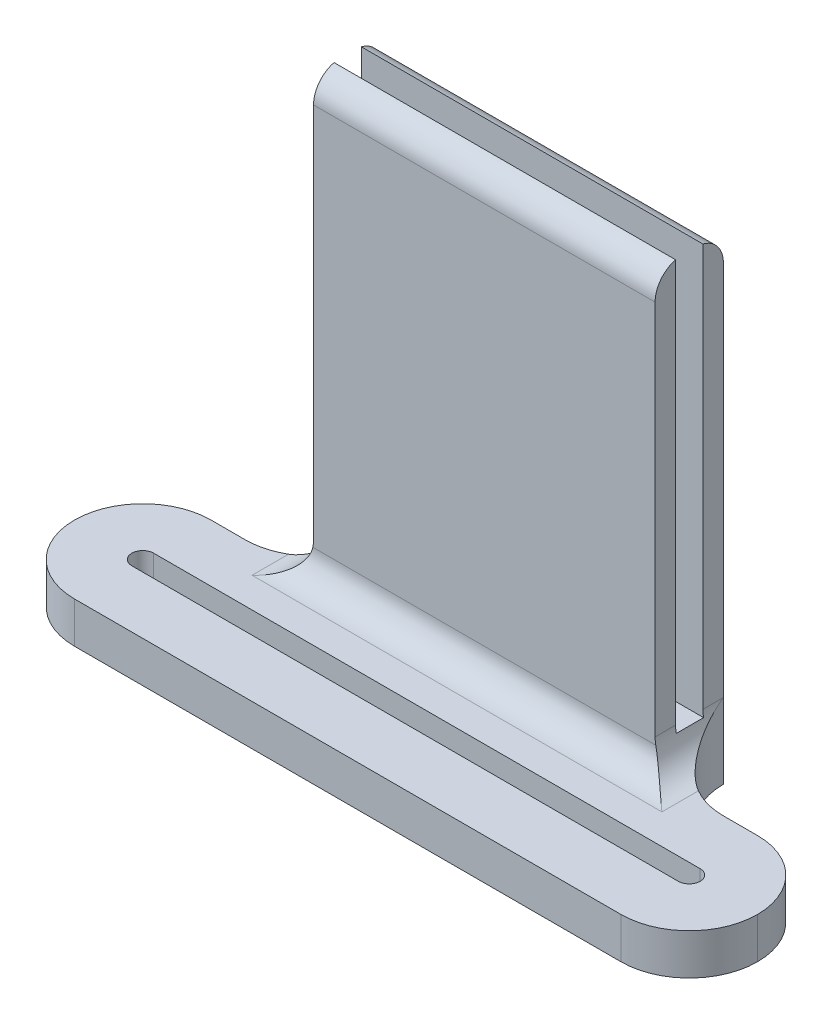
from build123d import *
from build123d.topology import SkipClean

# Parameters (mm, degrees)
SKETCH1_W           = 50
SKETCH1_H           = 10
BOSS_EXTRUDE1_DEPTH = 70
SKETCH2_W           = 50
SKETCH2_H           = 4
CUT_EXTRUDE1_DEPTH  = 60
SKETCH3_W           = 100
SKETCH3_H           = 6
BOSS_EXTRUDE2_DEPTH = 20
FILLET1_R           = 10
FILLET2_R           = 10
FILLET3_R           = 5
CUT_EXTRUDE2_DEPTH  = 85.976467331
FILLET4_R           = 4
FILLET5_R           = 4


# Some blends are built 0.0001 mm under size
with BuildPart() as part:
    # Sketch1 → Boss-Extrude1 (new body)
    with BuildSketch(Plane(origin=(0, 0, 0), x_dir=(1, 0, 0), z_dir=(0, 1, 0))):
        Rectangle(SKETCH1_W, SKETCH1_H)
    extrude(amount=BOSS_EXTRUDE1_DEPTH)

    # Sketch2 → Cut-Extrude1 (cut)
    with BuildSketch(Plane(origin=(0, 70, 0), x_dir=(1, 0, 0), z_dir=(0, 1, 0))):
        Rectangle(SKETCH2_W, SKETCH2_H)
    extrude(amount=-CUT_EXTRUDE1_DEPTH, mode=Mode.SUBTRACT)

    # Sketch3 → Boss-Extrude2 (add)
    with BuildSketch(Plane.XY.offset(5)):
        with Locations((0, 3)):
            Rectangle(SKETCH3_W, SKETCH3_H)
    extrude(amount=BOSS_EXTRUDE2_DEPTH)

    # Fillet1
    fillet1_edges = [part.edges().sort_by_distance(p)[0] for p in [
        (50, 3, 25),
        (-50, 3, 25),
        (-50, 3, 5),
        (50, 3, 5),
    ]]
    fillet(fillet1_edges, radius=FILLET1_R - 0.0001)  # a hair under: the kernel refuses the full size

    # Fillet2
    fillet2_edges = [part.edges().sort_by_distance(p)[0] for p in [
        (-25, 3, 5),
        (25, 3, 5),
    ]]
    fillet(fillet2_edges, radius=FILLET2_R - 0.0001)  # a hair under: the kernel refuses the full size

    # Fillet3
    # the kernel refuses this fillet: 5 mm, written as the material it adds along each edge
    with BuildSketch(Plane(origin=(-25, 6, 5), x_dir=(-1, 0, 0), z_dir=(0, 0, -1))) as fillet3_piece_1_section:
        with BuildLine():
            CenterArc((FILLET3_R, FILLET3_R), FILLET3_R, 180, 90)
            Line((0, FILLET3_R), (0, 0))
            Line((0, 0), (FILLET3_R, 0))
        make_face()
    fillet3_piece_1 = extrude(amount=22.4999, mode=Mode.PRIVATE)
    fillet3_piece_1 = fillet3_piece_1 - Plane(origin=(-34.9999, 7.107412722, -4.9999), x_dir=(0, 0, 1), z_dir=(0, 1, 0)) * Cylinder(9.9999, 65, mode=Mode.PRIVATE)
    fillet3_piece_1 = split(fillet3_piece_1, bisect_by=Plane(origin=(-26.097313128, 7.107412722, -5), z_dir=(0, 0, 1)), keep=Keep.TOP, mode=Mode.PRIVATE)
    fillet3_piece_1 = split(fillet3_piece_1, bisect_by=Plane(origin=(-26.097313128, 10, 3.51164162), z_dir=(0, -1, 0)), keep=Keep.TOP, mode=Mode.PRIVATE)
    add(fillet3_piece_1)
    with BuildSketch(Plane(origin=(-25, 6, 5), x_dir=(-1, 0, 0), z_dir=(0, 0, -1))) as fillet3_piece_2_section:
        with BuildLine():
            CenterArc((FILLET3_R, FILLET3_R), FILLET3_R, 180, 90)
            Line((0, FILLET3_R), (0, 0))
            Line((0, 0), (FILLET3_R, 0))
        make_face()
    fillet3_piece_2 = extrude(amount=22.4999, mode=Mode.PRIVATE)
    fillet3_piece_2 = split(fillet3_piece_2, bisect_by=Plane(origin=(-25.030252938, 10, 3.5), z_dir=(0, 1, 0)), keep=Keep.TOP, mode=Mode.PRIVATE)
    fillet3_piece_2 = split(fillet3_piece_2, bisect_by=Plane(origin=(-25.030252938, 10.249492121, 2), z_dir=(0, 0, 1)), keep=Keep.TOP, mode=Mode.PRIVATE)
    add(fillet3_piece_2)
    with BuildSketch(Plane(origin=(-25, 6, 17.5), x_dir=(-1, 0, 0), z_dir=(0, 0, -1))) as fillet3_piece_3_section:
        with BuildLine():
            CenterArc((FILLET3_R, FILLET3_R), FILLET3_R, 180, 90)
            Line((0, FILLET3_R), (0, 0))
            Line((0, 0), (FILLET3_R, 0))
        make_face()
    fillet3_piece_3 = extrude(amount=34.9999, mode=Mode.PRIVATE)
    fillet3_piece_3 = fillet3_piece_3 - Plane(origin=(-34.9999, 10.264980521, -4.9999), x_dir=(0, 0, 1), z_dir=(0, 1, 0)) * Cylinder(9.9999, 90, mode=Mode.PRIVATE)
    fillet3_piece_3 = split(fillet3_piece_3, bisect_by=Plane(origin=(-25.027128676, 10.264980521, -5), z_dir=(0, 0, 1)), keep=Keep.TOP, mode=Mode.PRIVATE)
    fillet3_piece_3 = split(fillet3_piece_3, bisect_by=Plane(origin=(-25.027128676, 10.264980521, -2), z_dir=(0, 0, -1)), keep=Keep.TOP, mode=Mode.PRIVATE)
    add(fillet3_piece_3)
    with BuildSketch(Plane(origin=(25, 6, 5), x_dir=(1, 0, 0), z_dir=(0, 0, -1))) as fillet3_piece_4_section:
        with BuildLine():
            CenterArc((FILLET3_R, -FILLET3_R), FILLET3_R, 90, 90)
            Line((0, -FILLET3_R), (0, 0))
            Line((0, 0), (FILLET3_R, 0))
        make_face()
    fillet3_piece_4 = extrude(amount=22.4999, mode=Mode.PRIVATE)
    fillet3_piece_4 = fillet3_piece_4 - Plane(origin=(34.9999, 7.107412722, -4.9999), x_dir=(0, 0, 1), z_dir=(0, 1, 0)) * Cylinder(9.9999, 65, mode=Mode.PRIVATE)
    fillet3_piece_4 = split(fillet3_piece_4, bisect_by=Plane(origin=(26.097313128, 7.107412722, -5), z_dir=(0, 0, 1)), keep=Keep.TOP, mode=Mode.PRIVATE)
    fillet3_piece_4 = split(fillet3_piece_4, bisect_by=Plane(origin=(26.097313128, 10, 3.51164162), z_dir=(0, -1, 0)), keep=Keep.TOP, mode=Mode.PRIVATE)
    add(fillet3_piece_4)
    with BuildSketch(Plane(origin=(25, 6, 5), x_dir=(1, 0, 0), z_dir=(0, 0, -1))) as fillet3_piece_5_section:
        with BuildLine():
            CenterArc((FILLET3_R, -FILLET3_R), FILLET3_R, 90, 90)
            Line((0, -FILLET3_R), (0, 0))
            Line((0, 0), (FILLET3_R, 0))
        make_face()
    fillet3_piece_5 = extrude(amount=22.4999, mode=Mode.PRIVATE)
    fillet3_piece_5 = split(fillet3_piece_5, bisect_by=Plane(origin=(25.030252938, 10, 3.5), z_dir=(0, 1, 0)), keep=Keep.TOP, mode=Mode.PRIVATE)
    fillet3_piece_5 = split(fillet3_piece_5, bisect_by=Plane(origin=(25.030252938, 10.249492121, 2), z_dir=(0, 0, 1)), keep=Keep.TOP, mode=Mode.PRIVATE)
    add(fillet3_piece_5)
    with BuildSketch(Plane(origin=(25, 6, 17.5), x_dir=(1, 0, 0), z_dir=(0, 0, -1))) as fillet3_piece_6_section:
        with BuildLine():
            CenterArc((FILLET3_R, -FILLET3_R), FILLET3_R, 90, 90)
            Line((0, -FILLET3_R), (0, 0))
            Line((0, 0), (FILLET3_R, 0))
        make_face()
    fillet3_piece_6 = extrude(amount=34.9999, mode=Mode.PRIVATE)
    fillet3_piece_6 = fillet3_piece_6 - Plane(origin=(34.9999, 10.264980521, -4.9999), x_dir=(0, 0, 1), z_dir=(0, 1, 0)) * Cylinder(9.9999, 90, mode=Mode.PRIVATE)
    fillet3_piece_6 = split(fillet3_piece_6, bisect_by=Plane(origin=(25.027128676, 10.264980521, -5), z_dir=(0, 0, 1)), keep=Keep.TOP, mode=Mode.PRIVATE)
    fillet3_piece_6 = split(fillet3_piece_6, bisect_by=Plane(origin=(25.027128676, 10.264980521, -2), z_dir=(0, 0, -1)), keep=Keep.TOP, mode=Mode.PRIVATE)
    add(fillet3_piece_6)

    # Sketch4 → Cut-Extrude2 (cut, through all)
    with SkipClean():  # the faces are left unmerged after this step: merging them gives an invalid solid
        with BuildSketch(Plane(origin=(0, 6, 0), x_dir=(1, 0, 0), z_dir=(0, 1, 0))):
            with BuildLine():
                Line((-40, -13.4), (40, -13.4))
                ThreePointArc((40, -13.4), (41.6, -15), (40, -16.6))
                Line((40, -16.6), (-40, -16.6))
                ThreePointArc((-40, -16.6), (-41.6, -15), (-40, -13.4))
            make_face()
        extrude(amount=-CUT_EXTRUDE2_DEPTH, mode=Mode.SUBTRACT)
    add(part.part.scale(1), mode=Mode.REPLACE)  # the faces are merged on a copy

    # Fillet4
    # the kernel refuses this fillet: 4 mm, written as the material it takes off along each edge
    with BuildSketch(Plane(origin=(-34.682458366, 70, 5), x_dir=(0, -1, 0), z_dir=(1, 0, 0))) as fillet4_piece_1:
        with BuildLine():
            CenterArc((3.872983346, 4), FILLET4_R, 194.477512186, 75.522487814)
            Line((0, 3), (-0.077459667, 2.98))
            ThreePointArc((-0.077459667, 2.98), (-0.08, 1.5), (-0.08, 0))
            Line((-0.08, 0), (0, -0.08))
            Line((0, -0.08), (3.872983346, -0.08))
            Line((3.872983346, -0.08), (3.872983346, 0))
        make_face()
    extrude(amount=69.364916731, mode=Mode.SUBTRACT)
    with BuildSketch(Plane(origin=(34.682458366, 70, -5), x_dir=(0, 0, 1), z_dir=(-1, 0, 0))) as fillet4_piece_2:
        with BuildLine():
            CenterArc((4, -3.872983346), FILLET4_R, 104.477512186, 75.522487814)
            Line((0, -3.872983346), (-0.08, -3.872983346))
            Line((-0.08, -3.872983346), (-0.08, 0))
            Line((-0.08, 0), (0, 0.08))
            ThreePointArc((0, 0.08), (1.5, 0.08), (2.98, 0.077459667))
            Line((2.98, 0.077459667), (3, 0))
        make_face()
    extrude(amount=69.364916731, mode=Mode.SUBTRACT)

    # Fillet5
    fillet5_edges = [part.edges().sort_by_distance(p)[0] for p in [
        (0, 6, 5),
    ]]
    fillet(fillet5_edges, radius=FILLET5_R)


solid = part.part
